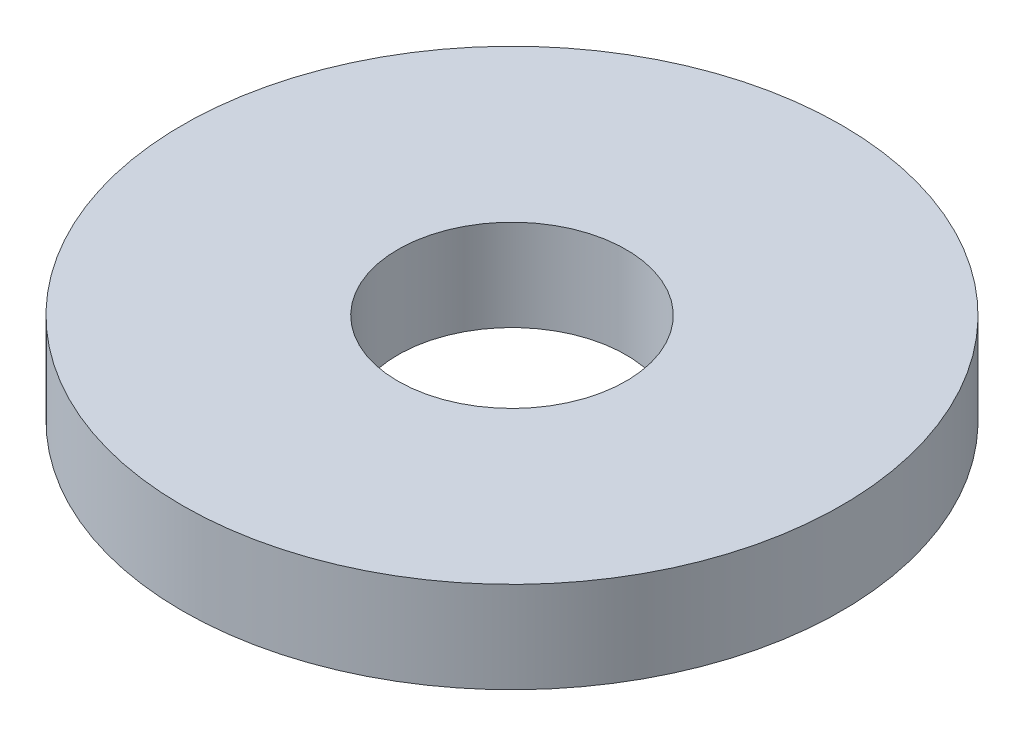
from build123d import *

# Parameters (mm, degrees)
SKETCH1_R           = 65
BOSS_EXTRUDE1_DEPTH = 18
SKETCH2_R           = 22.5
CUT_EXTRUDE1_DEPTH  = 94.669632219


with BuildPart() as part:
    # Sketch1 → Boss-Extrude1 (new body)
    with BuildSketch(Plane(origin=(0, 0, 0), x_dir=(1, 0, 0), z_dir=(0, 1, 0))):
        Circle(SKETCH1_R)
    extrude(amount=BOSS_EXTRUDE1_DEPTH)

    # Sketch2 → Cut-Extrude1 (cut, through all)
    with BuildSketch(Plane(origin=(0, 0, 0), x_dir=(1, 0, 0), z_dir=(0, 1, 0))):
        Circle(SKETCH2_R)
    extrude(amount=CUT_EXTRUDE1_DEPTH, mode=Mode.SUBTRACT)


solid = part.part
